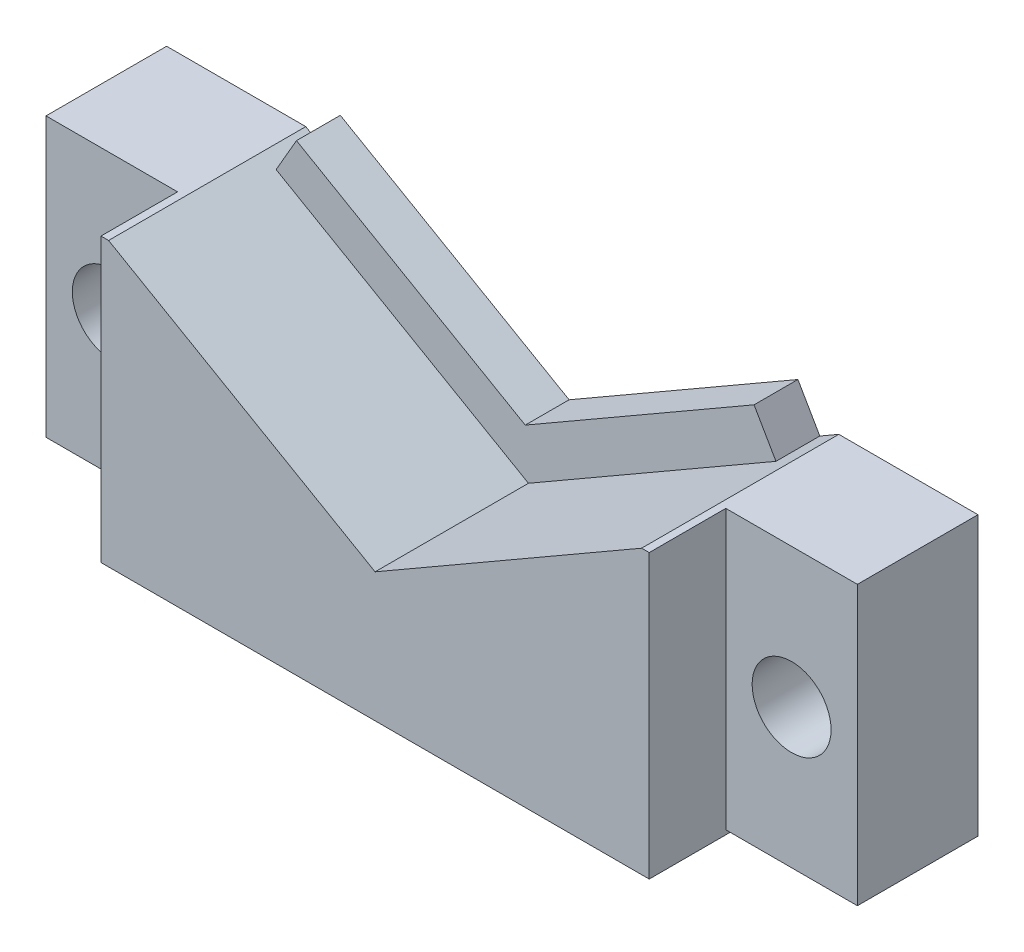
from build123d import *

# Parameters (mm, degrees)
SKETCH2_R               = 18.5
SKETCH2_R_2             = 1.8
BOSS_EXTRUDE1_DEPTH     = 3
SKETCH3_R               = 6.5
CUT_EXTRUDE1_DEPTH      = 3
BOSS_EXTRUDE2_START     = -3
BOSS_EXTRUDE2_DEPTH     = 3
SKETCH5_W               = 37
SKETCH5_H               = 5
BOSS_EXTRUDE3_DEPTH     = 90
SKETCH6_W               = 37
SKETCH6_H               = 15.5
BOSS_EXTRUDE4_DEPTH     = 5
SKETCH7_W               = 6
SKETCH7_H               = 20.5
BOSS_EXTRUDE5_DEPTH     = 20
SKETCH8_W               = 25
SKETCH8_H               = 15.5
CUT_EXTRUDE2_DEPTH      = 10
SKETCH9_W               = 25
SKETCH9_H               = 5
BOSS_EXTRUDE6_DEPTH     = 20
BOSS_EXTRUDE7_REACH     = 128.813
SKETCH10_W              = 5
SKETCH10_H              = 25
SKETCH11_W              = 25
SKETCH11_H              = 20
CUT_EXTRUDE3_DEPTH      = 137.880422267
SKETCH13_W              = 13
SKETCH13_H              = 60
CUT_EXTRUDE5_DEPTH      = 127.957670111
BOSS_EXTRUDE8_DEPTH     = 35
SKETCH16_W              = 37
SKETCH16_H              = 8
BOSS_EXTRUDE9_DEPTH     = 13
SKETCH17_W              = 37
SKETCH17_H              = 8
BOSS_EXTRUDE10_DEPTH    = 13
FILLET1_START           = -18.5
FILLET1_DEPTH           = 37
FILLET2_R               = 8
SKETCH18_W              = 37
SKETCH18_H              = 75
CUT_EXTRUDE6_DEPTH      = 0.001
SKETCH19_R              = 1.8
CUT_EXTRUDE7_DEPTH      = 6
SKETCH20_W              = 7
SKETCH20_H              = 5
CUT_EXTRUDE8_DEPTH      = 20
CUT_EXTRUDE9_DEPTH      = 127.957670111
CUT_EXTRUDE9_DEPTH_BACK = 127.957670111
CUT_EXTRUDE10_DEPTH     = 137.880422267
CUT_EXTRUDE11_DEPTH     = 15
BOSS_EXTRUDE11_DEPTH    = 7.5
BOSS_EXTRUDE12_DEPTH    = 7.5
SKETCH27_W              = 27
SKETCH27_H              = 53
CUT_EXTRUDE13_DEPTH     = 10
BOSS_EXTRUDE13_DEPTH    = 6.9930205
SKETCH29_W              = 6
SKETCH29_H              = 13.094091563
CUT_EXTRUDE14_DEPTH     = 3.5
SKETCH30_W              = 6
SKETCH30_H              = 12.694091563
BOSS_EXTRUDE14_DEPTH    = 3.5
CUT_EXTRUDE15_REACH     = 128.958
SKETCH31_W              = 3.5
SKETCH31_H              = 13.094091563
CUT_EXTRUDE16_START     = -6.993021
SKETCH32_R              = 1.8
CUT_EXTRUDE16_DEPTH     = 6.993021
SKETCH33_R              = 1.8
CUT_EXTRUDE17_DEPTH     = 3.4930205
SKETCH34_R              = 1.8
BOSS_EXTRUDE15_DEPTH    = 2
SKETCH35_W              = 37
SKETCH35_H              = 8.9930205
CUT_EXTRUDE18_DEPTH     = 2
BOSS_EXTRUDE16_DEPTH    = 2


with BuildPart() as part:
    # Sketch2 → Boss-Extrude1 (new body)
    with BuildSketch(Plane(origin=(0, 0, 0), x_dir=(1, 0, 0), z_dir=(0, 1, 0))):
        with Locations(Location((0, 0, 0), (0, 0, 270))):
            Circle(SKETCH2_R)
        with Locations(Location((-15.5, 0, 0), (0, 0, 270))):
            Circle(SKETCH2_R_2, mode=Mode.SUBTRACT)
        with Locations(Location((-7.75, 13.423393759, 0), (0, 0, 270))):
            Circle(SKETCH2_R_2, mode=Mode.SUBTRACT)
        with Locations(Location((7.75, 13.423393759, 0), (0, 0, 270))):
            Circle(SKETCH2_R_2, mode=Mode.SUBTRACT)
        with Locations(Location((15.5, 0, 0), (0, 0, 270))):
            Circle(SKETCH2_R_2, mode=Mode.SUBTRACT)
        with Locations(Location((7.75, -13.423393759, 0), (0, 0, 270))):
            Circle(SKETCH2_R_2, mode=Mode.SUBTRACT)
        with Locations(Location((-7.75, -13.423393759, 0), (0, 0, 270))):
            Circle(SKETCH2_R_2, mode=Mode.SUBTRACT)
    extrude(amount=BOSS_EXTRUDE1_DEPTH)

    # Sketch3 → Cut-Extrude1 (cut)
    with BuildSketch(Plane(origin=(0, 3, 0), x_dir=(1, 0, 0), z_dir=(0, 1, 0))):
        with Locations(Location((0, -7, 0), (0, 0, 270))):
            Circle(SKETCH3_R)
    extrude(amount=-CUT_EXTRUDE1_DEPTH, mode=Mode.SUBTRACT)

    # Sketch4 → Boss-Extrude2 (add)
    with BuildSketch(Plane(origin=(0, 3, 0), x_dir=(1, 0, 0), z_dir=(0, 1, 0)).offset(BOSS_EXTRUDE2_START)):
        with BuildLine():
            Line((18.5, 30.5), (-18.5, 30.5))
            Line((-18.5, 30.5), (-18.5, 0))
            ThreePointArc((-18.5, 0), (0, 18.5), (18.5, 0))
            Line((18.5, 0), (18.5, 30.5))
        make_face()
        with BuildLine():
            ThreePointArc((18.5, 0), (0, -18.5), (-18.5, 0))
            Line((-18.5, 0), (-18.5, -44.5))
            Line((-18.5, -44.5), (18.5, -44.5))
            Line((18.5, -44.5), (18.5, 0))
        make_face()
    extrude(amount=BOSS_EXTRUDE2_DEPTH)

    # Sketch5 → Boss-Extrude3 (add)
    with BuildSketch(Plane(origin=(0, 3, 0), x_dir=(1, 0, 0), z_dir=(0, 1, 0))):
        with Locations((0, 28)):
            Rectangle(SKETCH5_W, SKETCH5_H)
        with Locations((0, -42)):
            Rectangle(SKETCH5_W, SKETCH5_H)
    extrude(amount=BOSS_EXTRUDE3_DEPTH)

    # Sketch6 → Boss-Extrude4 (add)
    with BuildSketch(Plane(origin=(0, 93, 0), x_dir=(1, 0, 0), z_dir=(0, 1, 0))):
        with Locations((0, 17.75)):
            Rectangle(SKETCH6_W, SKETCH6_H)
        with Locations((0, -31.75)):
            Rectangle(SKETCH6_W, SKETCH6_H)
    extrude(amount=-BOSS_EXTRUDE4_DEPTH)

    # Sketch7 → Boss-Extrude5 (add)
    with BuildSketch(Plane(origin=(0, 93, 0), x_dir=(1, 0, 0), z_dir=(0, 1, 0))):
        with Locations((-15.5, 20.25)):
            Rectangle(SKETCH7_W, SKETCH7_H)
        with Locations((15.5, 20.25)):
            Rectangle(SKETCH7_W, SKETCH7_H)
        with Locations((-15.5, -34.25)):
            Rectangle(SKETCH7_W, SKETCH7_H)
        with Locations((15.5, -34.25)):
            Rectangle(SKETCH7_W, SKETCH7_H)
    extrude(amount=BOSS_EXTRUDE5_DEPTH)

    # Sketch8 → Cut-Extrude2 (cut)
    with BuildSketch(Plane(origin=(0, 93, 0), x_dir=(1, 0, 0), z_dir=(0, 1, 0))):
        with Locations((0, 17.75)):
            Rectangle(SKETCH8_W, SKETCH8_H)
        with Locations((0, -31.75)):
            Rectangle(SKETCH8_W, SKETCH8_H)
    extrude(amount=-CUT_EXTRUDE2_DEPTH, mode=Mode.SUBTRACT)

    # Sketch9 → Boss-Extrude6 (add)
    with BuildSketch(Plane(origin=(0, 93, 0), x_dir=(1, 0, 0), z_dir=(0, 1, 0))):
        with Locations((0, 28)):
            Rectangle(SKETCH9_W, SKETCH9_H)
        with Locations((0, -42)):
            Rectangle(SKETCH9_W, SKETCH9_H)
    extrude(amount=BOSS_EXTRUDE6_DEPTH)

    # Sketch10 → Boss-Extrude7 (add, up to next)
    with BuildSketch(Plane(origin=(0, 0, 24), x_dir=(-1, 0, 0), z_dir=(0, 0, -1)), mode=Mode.PRIVATE) as boss_extrude7_sk1:
        with Locations((16, 100.5)):
            Rectangle(SKETCH10_W, SKETCH10_H)
    boss_extrude7_tool1 = extrude(boss_extrude7_sk1.sketch, amount=BOSS_EXTRUDE7_REACH, mode=Mode.PRIVATE) - part.part
    # Sketch10 → Boss-Extrude7 (add, up to next)
    with BuildSketch(Plane(origin=(0, 0, 24), x_dir=(-1, 0, 0), z_dir=(0, 0, -1)), mode=Mode.PRIVATE) as boss_extrude7_sk2:
        with Locations((-16, 100.5)):
            Rectangle(SKETCH10_W, SKETCH10_H)
    boss_extrude7_tool2 = extrude(boss_extrude7_sk2.sketch, amount=BOSS_EXTRUDE7_REACH, mode=Mode.PRIVATE) - part.part
    add(boss_extrude7_tool1.solids().sort_by_distance((-16, 100.5, 24))[0])
    add(boss_extrude7_tool2.solids().sort_by_distance((16, 100.5, 24))[0])

    # Sketch11 → Cut-Extrude3 (cut, through all)
    with BuildSketch(Plane.XY.offset(44.5)):
        with Locations((0, 103)):
            Rectangle(SKETCH11_W, SKETCH11_H)
    extrude(amount=-CUT_EXTRUDE3_DEPTH, mode=Mode.SUBTRACT)

    # Sketch13 → Cut-Extrude5 (cut, through all)
    with BuildSketch(Plane(origin=(18.5, 0, 0), x_dir=(0, 0, -1), z_dir=(1, 0, 0))):
        with Locations((-38, 83)):
            Rectangle(SKETCH13_W, SKETCH13_H)
        with Locations((24, 83)):
            Rectangle(SKETCH13_W, SKETCH13_H)
    extrude(amount=-CUT_EXTRUDE5_DEPTH, mode=Mode.SUBTRACT)


with BuildPart() as cut_extrude5_piece_1:
    # of the separate pieces the step leaves, piece 1, a body of its own (cut_extrude5_pieces)
    add(part.part.solids().sort_by_distance((-7.75, 0, 15.223393759))[0])



with BuildPart() as cut_extrude5_piece_2:
    # of the separate pieces the step leaves, piece 2, a body of its own (cut_extrude5_pieces)
    add(part.part.solids().sort_by_distance((-18.5, 113, 31.5))[0])



with BuildPart() as cut_extrude5_piece_3:
    # of the separate pieces the step leaves, piece 3, a body of its own (cut_extrude5_pieces)
    add(part.part.solids().sort_by_distance((18.5, 113, 31.5))[0])


with BuildPart() as cut_extrude5_piece_2_1:
    add(cut_extrude5_piece_2.part)

    add(cut_extrude5_piece_3.part)  # Boss-Extrude8 merges Cut-Extrude5 piece 3
    # Sketch14 → Boss-Extrude8 (add)
    with BuildSketch(Plane.XZ.offset(-88)):
        Polygon((18.5, -17.5), (18.5, 31.5), (12.5, 31.5), (12.5, 24), (13.5, 24), (13.5, -10), (12.5, -10), (12.5, -17.5), align=None)
        Polygon((-12.5, 31.5), (-18.5, 31.5), (-18.5, -17.5), (-12.5, -17.5), (-12.5, -10), (-13.5, -10), (-13.5, 24), (-12.5, 24), align=None)
    extrude(amount=BOSS_EXTRUDE8_DEPTH)


with BuildPart() as cut_extrude5_piece_1_1:
    add(cut_extrude5_piece_1.part)

    add(cut_extrude5_piece_2_1.part)  # Boss-Extrude9 merges Cut-Extrude5 piece 2
    # Sketch16 → Boss-Extrude9 (add)
    with BuildSketch(Plane.XY.offset(31.5)):
        with Locations((0, 57)):
            Rectangle(SKETCH16_W, SKETCH16_H)
    extrude(amount=BOSS_EXTRUDE9_DEPTH)

    # Sketch17 → Boss-Extrude10 (add)
    with BuildSketch(Plane(origin=(0, 0, -17.5), x_dir=(-1, 0, 0), z_dir=(0, 0, -1))):
        with Locations((0, 57)):
            Rectangle(SKETCH17_W, SKETCH17_H)
    extrude(amount=BOSS_EXTRUDE10_DEPTH)

    # Fillet1: read off the stored shape, not the designer's step
    # Fillet1 outline → Fillet1 (add)
    with BuildSketch(Plane.YZ.offset(FILLET1_START)):
        with BuildLine():
            ThreePointArc((45, 39.5), (50.656854249, 37.156854249), (53, 31.5))
            Line((53, 31.5), (53, 39.5))
            Line((53, 39.5), (45, 39.5))
        make_face()
        with BuildLine():
            ThreePointArc((53, -17.5), (50.656854249, -23.156854249), (45, -25.5))
            Line((45, -25.5), (53, -25.5))
            Line((53, -25.5), (53, -17.5))
        make_face()
    extrude(amount=FILLET1_DEPTH)

    # Fillet2
    fillet2_edges = [cut_extrude5_piece_1_1.edges().sort_by_distance(p)[0] for p in [
        (15.5, 61, 31.5),
        (-15.5, 61, 31.5),
        (-15.5, 61, -17.5),
        (15.5, 61, -17.5),
    ]]
    fillet(fillet2_edges, radius=FILLET2_R)

    # Sketch18 → Cut-Extrude6 (cut)
    with BuildSketch(Plane(origin=(0, 3, 0), x_dir=(1, 0, 0), z_dir=(0, 1, 0))):
        with Locations((0, -7)):
            Rectangle(SKETCH18_W, SKETCH18_H)
    extrude(amount=CUT_EXTRUDE6_DEPTH, mode=Mode.SUBTRACT)


with BuildPart() as cut_extrude6_piece_1:
    # of the separate pieces the step leaves, piece 1, a body of its own (cut_extrude6_pieces)
    add(cut_extrude5_piece_1_1.part.solids().sort_by_distance((18.5, 61, 39.5))[0])


with BuildPart() as cut_extrude6_piece_2:
    # of the separate pieces the step leaves, piece 2, a body of its own (cut_extrude6_pieces)
    add(cut_extrude5_piece_1_1.part.solids().sort_by_distance((18.5, 3, 44.5))[0])


with BuildPart() as cut_extrude7_tool:
    # Sketch19 → Cut-Extrude7 (new body)
    with BuildSketch(Plane.XZ):
        with Locations(Location((-10, 42, 0), (0, 0, 270))):
            Circle(SKETCH19_R)
        with Locations(Location((10, 42, 0), (0, 0, 270))):
            Circle(SKETCH19_R)
        with Locations(Location((-10, -28, 0), (0, 0, 270))):
            Circle(SKETCH19_R)
        with Locations(Location((10, -28, 0), (0, 0, 270))):
            Circle(SKETCH19_R)
    extrude(amount=-CUT_EXTRUDE7_DEPTH)


with BuildPart() as cut_extrude6_piece_1_1:
    add(cut_extrude6_piece_1.part)

    # Cut-Extrude7: cut by cut_extrude7_tool
    add(cut_extrude7_tool.part, mode=Mode.SUBTRACT)

    # Sketch20 → Cut-Extrude8 (cut)
    with BuildSketch(Plane.XZ.offset(-6)):
        with Locations((-10, 42)):
            Rectangle(SKETCH20_W, SKETCH20_H)
        with Locations((10, 42)):
            Rectangle(SKETCH20_W, SKETCH20_H)
        with Locations((-10, -28)):
            Rectangle(SKETCH20_W, SKETCH20_H)
        with Locations((10, -28)):
            Rectangle(SKETCH20_W, SKETCH20_H)
    extrude(amount=-CUT_EXTRUDE8_DEPTH, mode=Mode.SUBTRACT)

    # Sketch21 → Cut-Extrude9 (cut, two sides: drawn at the far end of the back side and taken through both)
    with BuildSketch(Plane.ZY.offset(18.5).offset(-CUT_EXTRUDE9_DEPTH_BACK)):
        Polygon((-10.5069795, 97.546881465), (-10.5069795, 65.615135764), (5.458893351, 81.581008614), align=None)
        Polygon((24.5069795, 65.615135764), (8.541106649, 81.581008614), (24.5069795, 97.546881465), align=None)
        Polygon((-11.485209662, 61.67963441), (25.485209662, 61.67963441), (7, 77.078778227), align=None)
        Polygon((-9.842977491, 104.297173092), (23.842977491, 104.297173092), (7, 84.078778227), align=None)
    extrude(amount=CUT_EXTRUDE9_DEPTH + CUT_EXTRUDE9_DEPTH_BACK, mode=Mode.SUBTRACT)

    # Sketch22 → Cut-Extrude10 (cut, through all)
    with BuildSketch(Plane(origin=(0, 0, -30.5), x_dir=(-1, 0, 0), z_dir=(0, 0, -1))):
        Polygon((-13.5, 52.097217271), (-3, 41.509793962), (-13.5, 30.922370653), align=None)
        Polygon((3, 41.509793962), (13.5, 30.922370653), (13.5, 52.097217271), align=None)
        Polygon((-9.527716063, 30.922370653), (10.12909946, 30.922370653), (0, 40.845941529), align=None)
        Polygon((10.12909946, 52.097217271), (0, 42.173646395), (-9.527716063, 52.097217271), align=None)
    extrude(amount=-CUT_EXTRUDE10_DEPTH, mode=Mode.SUBTRACT)

    # Sketch25 → Boss-Extrude11 (add)
    with BuildSketch(Plane(origin=(0, 0, -17.5), x_dir=(-1, 0, 0), z_dir=(0, 0, -1))):
        Polygon((-12.5, 113), (12.5, 113), (12.5, 104.783121635), (0, 112), (-12.5, 104.783121635), align=None)
    extrude(amount=-BOSS_EXTRUDE11_DEPTH)

    # Sketch26 → Boss-Extrude12 (add)
    with BuildSketch(Plane.XY.offset(31.5)):
        Polygon((0, 112), (-12.5, 104.783121635), (-12.5, 113), (12.5, 113), (12.5, 104.783121635), align=None)
    extrude(amount=-BOSS_EXTRUDE12_DEPTH)

    # Sketch27 → Cut-Extrude13 (cut)
    with BuildSketch(Plane(origin=(0, 61, 0), x_dir=(1, 0, 0), z_dir=(0, 1, 0))):
        with Locations((0, -7)):
            Rectangle(SKETCH27_W, SKETCH27_H)
    extrude(amount=-CUT_EXTRUDE13_DEPTH, mode=Mode.SUBTRACT)

    # Sketch29 → Cut-Extrude14 (cut)
    with BuildSketch(Plane(origin=(0, 0, -17.5), x_dir=(-1, 0, 0), z_dir=(0, 0, -1))):
        with Locations((-15.5, 83.806075854)):
            Rectangle(SKETCH29_W, SKETCH29_H)
        with Locations((15.5, 83.806075854)):
            Rectangle(SKETCH29_W, SKETCH29_H)
    extrude(amount=-CUT_EXTRUDE14_DEPTH, mode=Mode.SUBTRACT)

    # Cut-Extrude15: up to this face of the body (flat: up to its plane)
    cut_extrude15_end = Plane(cut_extrude6_piece_1_1.part.faces().sort_by_distance((-18.5, 59.668655567, -28))[0])
    # Sketch31 → Cut-Extrude15 (cut, up to the picked face)
    with BuildSketch(Plane(origin=(18.5, 0, 0), x_dir=(0, 0, -1), z_dir=(1, 0, 0)), mode=Mode.PRIVATE) as cut_extrude15_sk1:
        with Locations((-29.75, 83.806075854)):
            Rectangle(SKETCH31_W, SKETCH31_H)
    cut_extrude15_tool1 = split(extrude(cut_extrude15_sk1.sketch, amount=-CUT_EXTRUDE15_REACH, mode=Mode.PRIVATE), bisect_by=cut_extrude15_end, keep=Keep.BOTH, mode=Mode.PRIVATE)
    add(cut_extrude15_tool1.solids().sort_by(Axis((18.5, 83.806076, 29.75), (-1, 0, 0)))[0], mode=Mode.SUBTRACT)


with BuildPart() as cut_extrude6_piece_2_1:
    add(cut_extrude6_piece_2.part)

    # Cut-Extrude7: cut by cut_extrude7_tool
    add(cut_extrude7_tool.part, mode=Mode.SUBTRACT)

    # Sketch23 → Cut-Extrude11 (cut)
    with BuildSketch(Plane.XZ):
        Polygon((-11.504954321, 36.262601208), (12.40534205, 36.262601208), (0.450193865, 27.658896237), align=None)
        Polygon((0.450193865, 25.758077697), (-11.504954321, 17.154372727), (12.40534205, 17.154372727), align=None)
        Polygon((-14.846233134, 34.405096401), (-14.846233134, 19.011877534), (-4.15152584, 26.708486967), align=None)
        Polygon((15.746620863, 19.011877534), (5.051913569, 26.708486967), (15.746620863, 34.405096401), align=None)
    extrude(amount=-CUT_EXTRUDE11_DEPTH, mode=Mode.SUBTRACT)


with BuildPart() as body_3:
    # Sketch28 → Boss-Extrude13 (new body)
    with BuildSketch(Plane(origin=(0, 0, -17.5), x_dir=(-1, 0, 0), z_dir=(0, 0, -1))):
        Polygon((-12.5, 90.353121635), (0, 83.143759666), (12.5, 90.353121635), (12.5, 77.259030072), (-12.5, 77.259030072), align=None)
    extrude(amount=-BOSS_EXTRUDE13_DEPTH)

    # Sketch30 → Boss-Extrude14 (add)
    with BuildSketch(Plane(origin=(0, 0, -17.5), x_dir=(-1, 0, 0), z_dir=(0, 0, -1))):
        with Locations((-15.5, 83.806075854)):
            Rectangle(SKETCH30_W, SKETCH30_H)
        with Locations((15.5, 83.806075854)):
            Rectangle(SKETCH30_W, SKETCH30_H)
    extrude(amount=-BOSS_EXTRUDE14_DEPTH)


with BuildPart() as cut_extrude16_tool:
    # Sketch32 → Cut-Extrude16 (new body)
    with BuildSketch(Plane(origin=(0, 0, -17.5), x_dir=(-1, 0, 0), z_dir=(0, 0, -1)).offset(CUT_EXTRUDE16_START)):
        with Locations((-15.5, 83.806075854)):
            Circle(SKETCH32_R)
        with Locations(Location((15.5, 83.806075854, 0), (0, 0, 180))):
            Circle(SKETCH32_R)
    extrude(amount=CUT_EXTRUDE16_DEPTH)


with BuildPart() as cut_extrude6_piece_1_2:
    add(cut_extrude6_piece_1_1.part)

    # Cut-Extrude16: cut by cut_extrude16_tool
    add(cut_extrude16_tool.part, mode=Mode.SUBTRACT)

    # Sketch33 → Cut-Extrude17 (cut)
    with BuildSketch(Plane.XY.offset(28)):
        with Locations((-15.5, 83.806075854)):
            Circle(SKETCH33_R)
        with Locations(Location((15.5, 83.806075854, 0), (0, 0, 180))):
            Circle(SKETCH33_R)
    extrude(amount=-CUT_EXTRUDE17_DEPTH, mode=Mode.SUBTRACT)


with BuildPart() as body_3_1:
    add(body_3.part)

    # Cut-Extrude16: cut by cut_extrude16_tool
    add(cut_extrude16_tool.part, mode=Mode.SUBTRACT)

    # Sketch34 → Boss-Extrude15 (add)
    with BuildSketch(Plane(origin=(0, 0, -17.5), x_dir=(-1, 0, 0), z_dir=(0, 0, -1))):
        Polygon((-12.5, 90.353121635), (-12.5, 90.153121635), (-18.5, 90.153121635), (-18.5, 77.459030072), (-12.5, 77.459030072), (-12.5, 77.259030072), (12.5, 77.259030072), (12.5, 77.459030072), (18.5, 77.459030072), (18.5, 90.153121635), (12.5, 90.153121635), (12.5, 90.353121635), (0, 83.143759666), align=None)
        with Locations((15.5, 83.806075854)):
            Circle(SKETCH34_R, mode=Mode.SUBTRACT)
        with Locations((-15.5, 83.806075854)):
            Circle(SKETCH34_R, mode=Mode.SUBTRACT)
    extrude(amount=BOSS_EXTRUDE15_DEPTH)

    # Sketch35 → Cut-Extrude18 (cut)
    with BuildSketch(Plane(origin=(0, 90.153121635, 0), x_dir=(1, 0, 0), z_dir=(0, 1, 0))):
        with Locations((0, 15.00348975)):
            Rectangle(SKETCH35_W, SKETCH35_H)
    extrude(amount=CUT_EXTRUDE18_DEPTH, mode=Mode.SUBTRACT)

    # Sketch36 → Boss-Extrude16 (add)
    with BuildSketch(Plane(origin=(0, 0, -19.5), x_dir=(-1, 0, 0), z_dir=(0, 0, -1))):
        Polygon((-11.286977809, 89.653512351), (-10.287759241, 91.386014084), (0.145594128, 85.368588405), (10.578947497, 91.386014084), (11.505482728, 89.779534835), (0, 83.143759666), align=None)
    extrude(amount=-BOSS_EXTRUDE16_DEPTH)


solid = body_3_1.part
